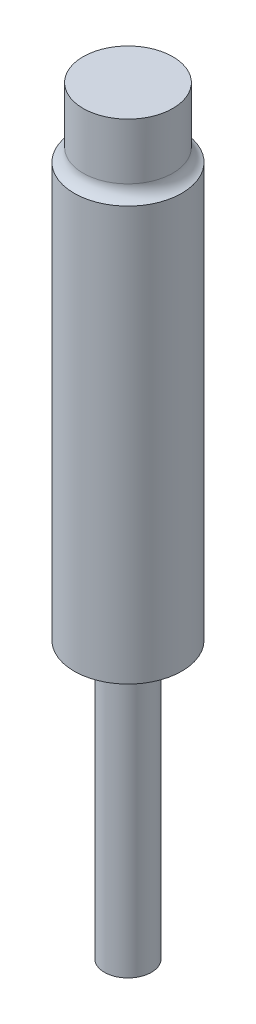
from build123d import *

# Parameters (mm, degrees)
CROQUIS1_R              = 3.9
SALIENTE_EXTRUIR1_DEPTH = 30
CROQUIS2_R              = 3.25
SALIENTE_EXTRUIR2_DEPTH = 5
CROQUIS3_R              = 1.7
SALIENTE_EXTRUIR3_DEPTH = 20
REDONDEO1_R             = 1


with BuildPart() as part:
    # Croquis1 → Saliente-Extruir1 (new body)
    with BuildSketch(Plane(origin=(0, 0, 0), x_dir=(1, 0, 0), z_dir=(0, 1, 0))):
        with Locations(Location((0, 0, 0), (0, 0, 270))):
            Circle(CROQUIS1_R)
    extrude(amount=SALIENTE_EXTRUIR1_DEPTH)

    # Croquis2 → Saliente-Extruir2 (add)
    with BuildSketch(Plane(origin=(0, 30, 0), x_dir=(1, 0, 0), z_dir=(0, 1, 0))):
        with Locations(Location((0, 0, 0), (0, 0, 270))):
            Circle(CROQUIS2_R)
    extrude(amount=SALIENTE_EXTRUIR2_DEPTH)

    # Croquis3 → Saliente-Extruir3 (add)
    with BuildSketch(Plane.XZ):
        with Locations(Location((0, 0, 0), (0, 0, 270))):
            Circle(CROQUIS3_R)
    extrude(amount=SALIENTE_EXTRUIR3_DEPTH)

    # Redondeo1
    # the kernel refuses this fillet: 1 mm, written as the material it adds along each edge
    with BuildSketch(Plane(origin=(0, 30, 0), x_dir=(0, 0, 1), z_dir=(-1, 0, 0))) as redondeo1_piece_1:
        with BuildLine():
            CenterArc((4.25, 0.9367497), REDONDEO1_R, 180, 69.512684885)
            Line((3.25, 0.9367497), (3.23, 0.9367497))
            Line((3.23, 0.9367497), (3.23, 0))
            Line((3.23, 0), (3.25, -0.02))
            ThreePointArc((3.25, -0.02), (3.575, -0.02), (3.893, -0.018734994))
            Line((3.893, -0.018734994), (3.9, 0))
        make_face()
    revolve(axis=Axis((0, 30, 0), (0, 1, 0)))


solid = part.part
